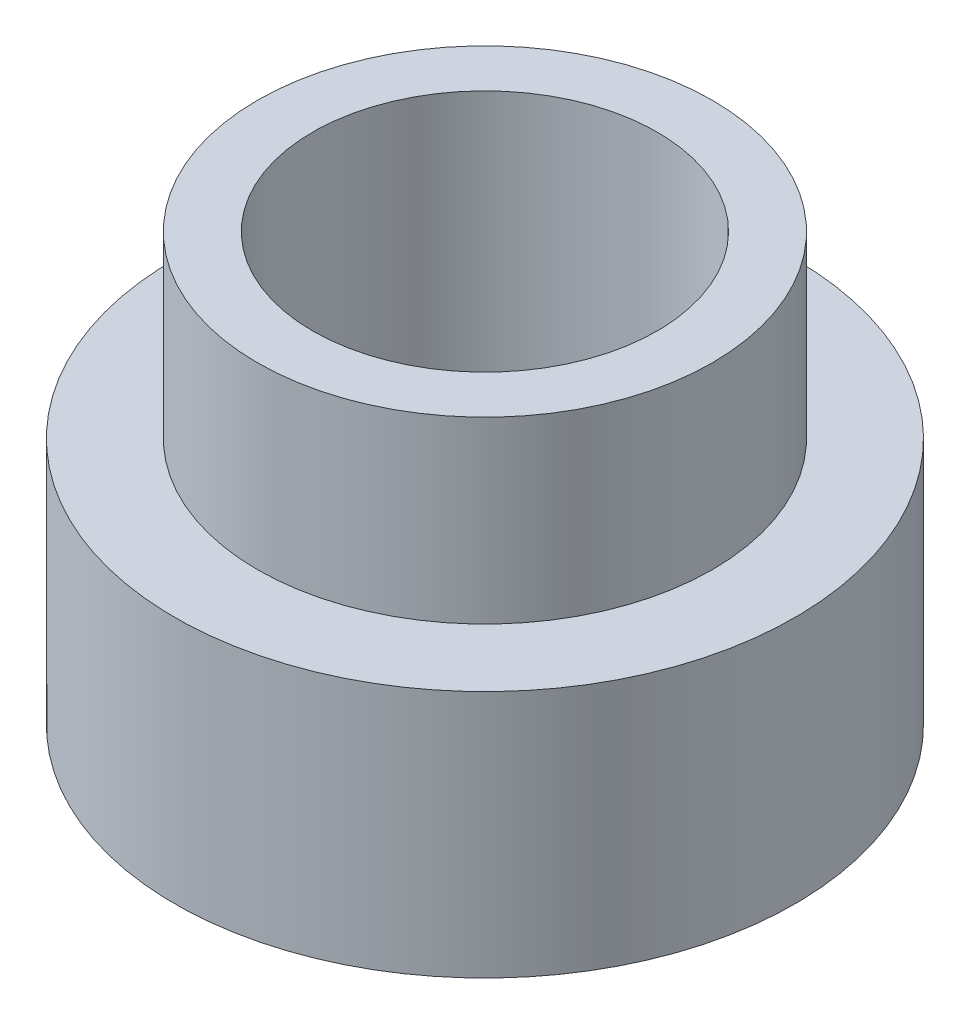
from build123d import *

# Parameters (mm, degrees)
SKETCH1_R           = 2.25
BOSS_EXTRUDE1_DEPTH = 3.1
SKETCH2_OUTSIDE_W   = 7.916
SKETCH2_OUTSIDE_H   = 7.916
SKETCH2_OUTSIDE_R   = 1.65
CUT_EXTRUDE1_DEPTH  = 1.3
SKETCH3_R           = 1.25
CUT_EXTRUDE2_DEPTH  = 5.442409256


with BuildPart() as part:
    # Sketch1 → Boss-Extrude1 (new body)
    with BuildSketch(Plane(origin=(0, 0, 0), x_dir=(1, 0, 0), z_dir=(0, 1, 0))):
        Circle(SKETCH1_R)
    extrude(amount=BOSS_EXTRUDE1_DEPTH)

    # Sketch2 outside → Cut-Extrude1 (cut)
    with BuildSketch(Plane(origin=(0, 3.1, 0), x_dir=(1, 0, 0), z_dir=(0, 1, 0))):
        Rectangle(SKETCH2_OUTSIDE_W, SKETCH2_OUTSIDE_H)
        Circle(SKETCH2_OUTSIDE_R, mode=Mode.SUBTRACT)
    extrude(amount=-CUT_EXTRUDE1_DEPTH, mode=Mode.SUBTRACT)

    # Sketch3 → Cut-Extrude2 (cut, through all)
    with BuildSketch(Plane(origin=(0, 3.1, 0), x_dir=(1, 0, 0), z_dir=(0, 1, 0))):
        Circle(SKETCH3_R)
    extrude(amount=-CUT_EXTRUDE2_DEPTH, mode=Mode.SUBTRACT)


solid = part.part
